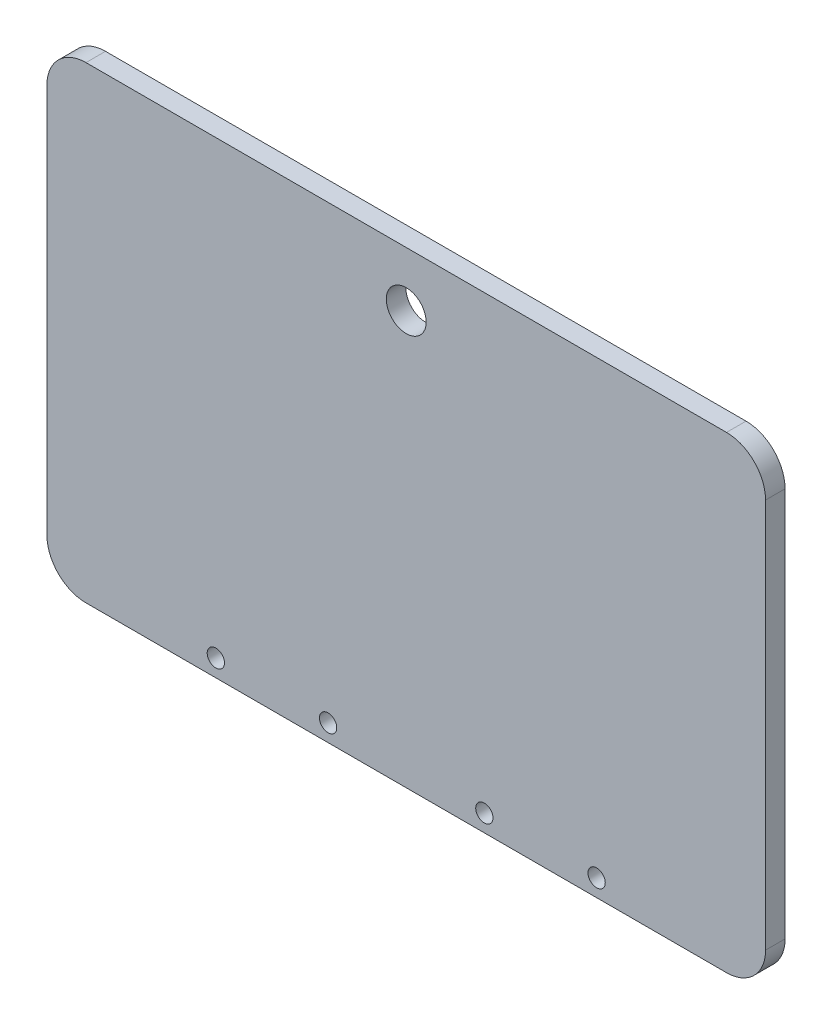
from build123d import *

# Parameters (mm, degrees)
SKETCH1_W              = 233.68
SKETCH1_H              = 152.146
BOSS_EXTRUDE1_DEPTH    = 6.35
F_10_CLEARANCE_HOLE1_D = 5.6134
SKETCH8_R              = 6.477
CUT_EXTRUDE1_DEPTH     = 279.917676414
FILLET1_R              = 12.7


with BuildPart() as part:
    # Sketch1 → Boss-Extrude1 (new body)
    with BuildSketch(Plane.XY):
        with Locations((116.84, 76.073)):
            Rectangle(SKETCH1_W, SKETCH1_H)
    extrude(amount=BOSS_EXTRUDE1_DEPTH)

    # #10 Clearance Hole1 (through all)
    with Locations(Plane.XY.offset(6.35)):
        with Locations((54.9275, 5.588), (91.44, 5.588), (142.24, 5.588), (178.7525, 5.588)):
            Hole(F_10_CLEARANCE_HOLE1_D / 2)

    # Sketch8 → Cut-Extrude1 (cut, through all)
    with BuildSketch(Plane.XY.offset(6.35)):
        with Locations((116.84, 134.366)):
            Circle(SKETCH8_R)
    extrude(amount=-CUT_EXTRUDE1_DEPTH, mode=Mode.SUBTRACT)

    # Fillet1
    fillet1_edges = [part.edges().sort_by_distance(p)[0] for p in [
        (233.68, 0, 3.175),
        (233.68, 152.146, 3.175),
        (0, 152.146, 3.175),
        (0, 0, 3.175),
    ]]
    fillet(fillet1_edges, radius=FILLET1_R)


solid = part.part
